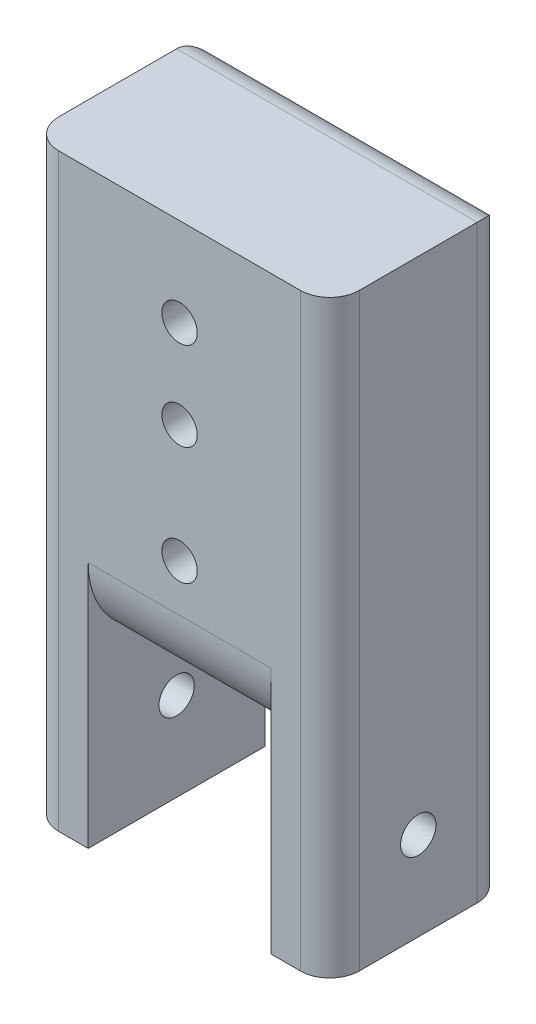
from build123d import *

# Parameters (mm, degrees)
BOSS_EXTRUDE1_DEPTH = 30
SKETCH2_R           = 3
CUT_EXTRUDE1_DEPTH  = 111
SKETCH3_R           = 3
CUT_EXTRUDE2_DEPTH  = 111
FILLET1_R           = 5
FILLET2_R           = 5
FILLET3_R           = 15


with BuildPart() as part:
    # Sketch1 → Boss-Extrude1 (new body)
    with BuildSketch(Plane.XY):
        Polygon((0, 0), (51, 0), (51, -100), (41, -100), (41, -73), (10, -73), (10, -100), (0, -100), align=None)
    extrude(amount=BOSS_EXTRUDE1_DEPTH)

    # Sketch2 → Cut-Extrude1 (cut)
    with BuildSketch(Plane(origin=(51, 0, 0), x_dir=(0, 0, -1), z_dir=(1, 0, 0))):
        with Locations(Location((-15, -85, 0), (0, 0, 90))):
            Circle(SKETCH2_R)
    extrude(amount=-CUT_EXTRUDE1_DEPTH, mode=Mode.SUBTRACT)

    # Sketch3 → Cut-Extrude2 (cut)
    with BuildSketch(Plane(origin=(0, 0, 0), x_dir=(-1, 0, 0), z_dir=(0, 0, -1))):
        with Locations((-25.5, -15)):
            Circle(SKETCH3_R)
        with Locations((-25.5, -30)):
            Circle(SKETCH3_R)
        with Locations((-25.5, -50)):
            Circle(SKETCH3_R)
    extrude(amount=-CUT_EXTRUDE2_DEPTH, mode=Mode.SUBTRACT)

    # Fillet1
    fillet1_edges = [part.edges().sort_by_distance(p)[0] for p in [
        (0, -50, 0),
        (25.5, 0, 0),
        (51, -50, 0),
    ]]
    fillet(fillet1_edges, radius=FILLET1_R)

    # Fillet2
    fillet2_edges = [part.edges().sort_by_distance(p)[0] for p in [
        (51, -50, 30),
        (0, -50, 30),
    ]]
    fillet(fillet2_edges, radius=FILLET2_R)

    # Fillet3
    fillet3_edges = [part.edges().sort_by_distance(p)[0] for p in [
        (25.5, -73, 30),
        (25.5, -73, 0),
    ]]
    fillet(fillet3_edges, radius=FILLET3_R - 0.0001)  # a hair under: the kernel refuses the full size


solid = part.part
